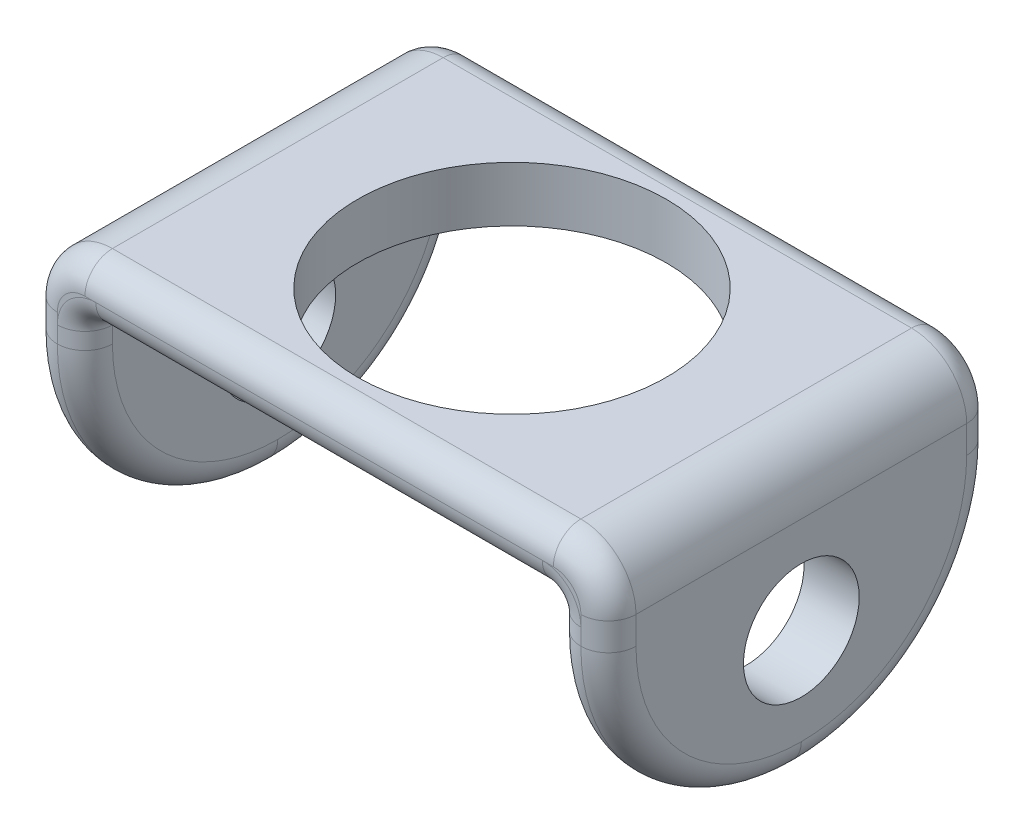
from build123d import *

# Parameters (mm, degrees)
SKETCH1_W           = 105
SKETCH1_H           = 70
SKETCH1_R           = 28
BOSS_EXTRUDE1_DEPTH = 10
SKETCH3_W           = 10
SKETCH3_H           = 70
BOSS_EXTRUDE2_DEPTH = 40
SKETCH5_R           = 10.5
CUT_EXTRUDE1_DEPTH  = 118.686022959
FILLET1_R           = 35
FILLET2_R           = 10
FILLET3_R           = 2
FILLET4_R           = 5


with BuildPart() as part:
    # Sketch1 → Boss-Extrude1 (new body)
    with BuildSketch(Plane(origin=(0, 0, 0), x_dir=(1, 0, 0), z_dir=(0, 1, 0))):
        Rectangle(SKETCH1_W, SKETCH1_H)
        with Locations(Location((0, 0, 0), (0, 0, 270))):
            Circle(SKETCH1_R, mode=Mode.SUBTRACT)
    extrude(amount=BOSS_EXTRUDE1_DEPTH)

    # Sketch3 → Boss-Extrude2 (add)
    with BuildSketch(Plane.XZ):
        with Locations((-47.5, 0)):
            Rectangle(SKETCH3_W, SKETCH3_H)
        with Locations((47.5, 0)):
            Rectangle(SKETCH3_W, SKETCH3_H)
    extrude(amount=BOSS_EXTRUDE2_DEPTH)

    # Sketch5 → Cut-Extrude1 (cut, through all)
    with BuildSketch(Plane(origin=(52.5, 0, 0), x_dir=(0, 0, -1), z_dir=(1, 0, 0))):
        with Locations((0, -17.5)):
            Circle(SKETCH5_R)
    extrude(amount=-CUT_EXTRUDE1_DEPTH, mode=Mode.SUBTRACT)

    # Fillet1
    fillet1_edges = [part.edges().sort_by_distance(p)[0] for p in [
        (47.5, -40, 35),
        (47.5, -40, -35),
        (-47.5, -40, 35),
        (-47.5, -40, -35),
    ]]
    fillet(fillet1_edges, radius=FILLET1_R - 0.0001)  # a hair under: the kernel refuses the full size

    # Fillet2
    fillet2_edges = [part.edges().sort_by_distance(p)[0] for p in [
        (52.5, 10, 0),
        (-52.5, 10, 0),
    ]]
    fillet(fillet2_edges, radius=FILLET2_R)

    # Fillet3
    fillet3_edges = [part.edges().sort_by_distance(p)[0] for p in [
        (-42.5, 0, 0),
        (42.5, 0, 0),
    ]]
    fillet(fillet3_edges, radius=FILLET3_R)

    # Fillet4
    fillet4_edges = [part.edges().sort_by_distance(p)[0] for p in [
        (-41.914213562, -0.585786438, 35),
        (-42.5, -29.748766631, 24.748766631),
        (-42.5, -29.748766631, -24.748766631),
        (-41.914213562, -0.585786438, -35),
        (0, 0, -35),
        (41.914213562, -0.585786438, -35),
        (42.5, -29.748766631, -24.748766631),
        (42.5, -29.748766631, 24.748766631),
        (41.914213562, -0.585786438, 35),
        (-49.571067812, 7.071067812, 35),
        (-52.5, -2.50005, 35),
        (-52.5, -29.748766631, 24.748766631),
        (-52.5, -29.748766631, -24.748766631),
        (-52.5, -2.50005, -35),
        (-49.571067812, 7.071067812, -35),
        (0, 10, -35),
        (49.571067812, 7.071067812, -35),
        (52.5, -2.50005, -35),
        (52.5, -29.748766631, -24.748766631),
        (52.5, -29.748766631, 24.748766631),
        (52.5, -2.50005, 35),
        (49.571067812, 7.071067812, 35),
        (0, 0, 35),
        (0, 10, 35),
        (-42.5, -3.50005, 35),
        (-42.5, -3.50005, -35),
        (42.5, -3.50005, -35),
        (42.5, -3.50005, 35),
    ]]
    fillet(fillet4_edges, radius=FILLET4_R - 0.0001)  # a hair under: the kernel refuses the full size


solid = part.part
